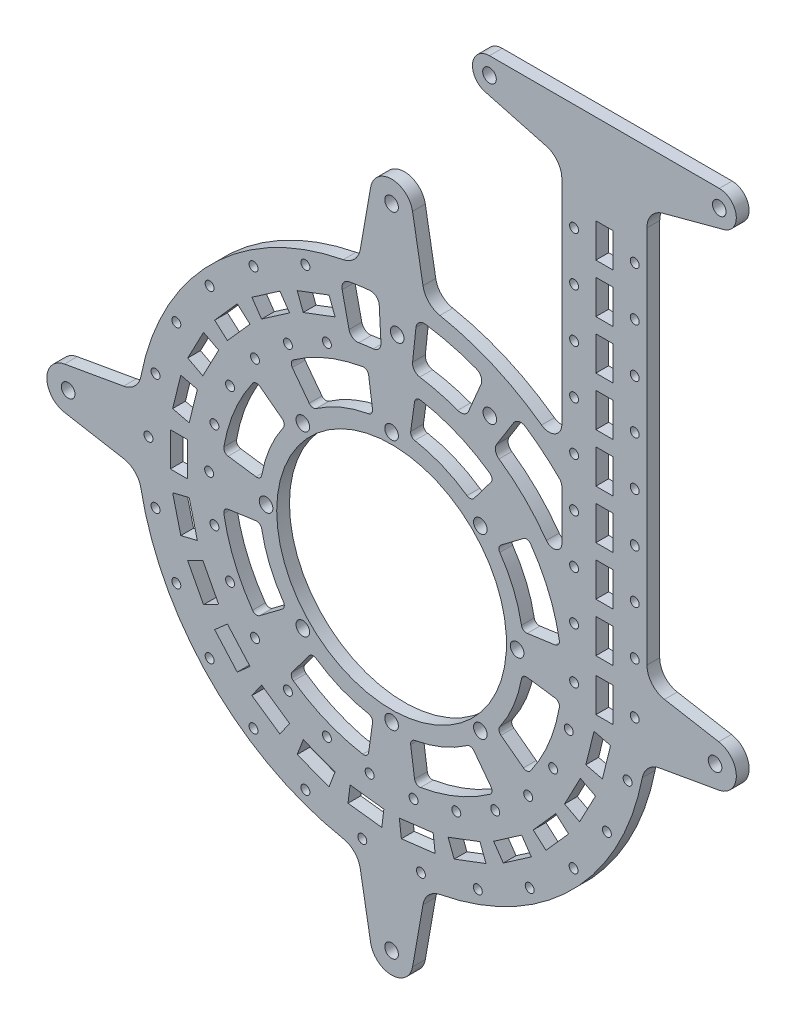
from build123d import *

# Parameters (mm, degrees)
SKETCH_1_W               = 200
SKETCH_1_H               = 300
EXTRUDE_1_DEPTH          = 3
SKETCH_7_R               = 27
CUT_EXTRUDE_4_DEPTH      = 10
SKETCH_3_W               = 4
SKETCH_3_H               = 8
CUT_EXTRUDE_2_DEPTH      = 10
SKETCH_5_OUTSIDE_W       = 274.114
SKETCH_5_OUTSIDE_H       = 374.114
CUT_EXTRUDE_3_DEPTH      = 10
SKETCH_8_R               = 1.6
CUT_EXTRUDE_5_DEPTH      = 10
PATTERN_CIRCULAR_1_COUNT = 26
SKETCH_9_R               = 1.6
CUT_EXTRUDE_6_DEPTH      = 10
PATTERN_CIRCULAR_2_COUNT = 8
SKETCH_11_W              = 4
SKETCH_11_H              = 8
CUT_EXTRUDE_7_DEPTH      = 10
PATTERN_LINEAR_1_COUNT   = 8
PATTERN_LINEAR_1_PITCH   = 11.5
EXTRUDE_START            = -3
EXTRUDE_2_DEPTH          = 3
SKETCH_13_R              = 1.05
CUT_EXTRUDE_8_DEPTH      = 10
PATTERN_CIRCULAR_3_COUNT = 26
SKETCH_14_R              = 1.05
CUT_EXTRUDE_9_DEPTH      = 10
PATTERN_LINEAR_2_COUNT   = 8
PATTERN_LINEAR_2_PITCH   = 11.5
SKETCH_15_R              = 1.6
CUT_EXTRUDE_10_DEPTH     = 10
CUT_EXTRUDE_11_DEPTH     = 10
CUT_EXTRUDE_12_DEPTH     = 10
FILLET_1_R               = 2


with BuildPart() as part:
    # 草图1 → 凸台-拉伸1 (new body)
    with BuildSketch(Plane.XY):
        Rectangle(SKETCH_1_W, SKETCH_1_H)
    extrude(amount=EXTRUDE_1_DEPTH)

    # 草图7 → 切除-拉伸4 (cut)
    with BuildSketch(Plane(origin=(0, 0, 0), x_dir=(-1, 0, 0), z_dir=(0, 0, -1))):
        Circle(SKETCH_7_R)
    extrude(amount=-CUT_EXTRUDE_4_DEPTH, mode=Mode.SUBTRACT)

    # 草图3 → 切除-拉伸2 (cut)
    with BuildSketch(Plane(origin=(0, 0, 0), x_dir=(-1, 0, 0), z_dir=(0, 0, -1))):
        with Locations((50, 0)):
            Rectangle(SKETCH_3_W, SKETCH_3_H)
    cut_extrude_2 = extrude(amount=-CUT_EXTRUDE_2_DEPTH, mode=Mode.SUBTRACT)

    # 草图5 outside → 切除-拉伸3 (cut)
    with BuildSketch(Plane.XY.offset(3)):
        Rectangle(SKETCH_5_OUTSIDE_W, SKETCH_5_OUTSIDE_H)
        with BuildLine():
            Line((40, 101.064727818), (40, 50.990195136))
            ThreePointArc((40, 50.990195136), (38.362770288, 48.317582717), (35.238095238, 48.562090606))
            ThreePointArc((35.238095238, 48.562090606), (23.864678316, 55.049769562), (11.354741948, 58.91578596))
            ThreePointArc((11.354741948, 58.91578596), (8.73750949, 60.31805029), (7.376931679, 62.957193902))
            Line((7.376931679, 62.957193902), (4.924038765, 76.868240888))
            ThreePointArc((4.924038765, 76.868240888), (0, 81), (-4.924038765, 76.868240888))
            Line((-4.924038765, 76.868240888), (-7.376931679, 62.957193902))
            ThreePointArc((-7.376931679, 62.957193902), (-8.73750949, 60.31805029), (-11.354741948, 58.91578596))
            ThreePointArc((-11.354741948, 58.91578596), (-42.426406871, 42.426406871), (-58.91578596, 11.354741948))
            ThreePointArc((-58.91578596, 11.354741948), (-60.31805029, 8.73750949), (-62.957193902, 7.376931679))
            Line((-62.957193902, 7.376931679), (-76.868240888, 4.924038765))
            ThreePointArc((-76.868240888, 4.924038765), (-81, 0), (-76.868240888, -4.924038765))
            Line((-76.868240888, -4.924038765), (-62.957193902, -7.376931679))
            ThreePointArc((-62.957193902, -7.376931679), (-60.31805029, -8.73750949), (-58.91578596, -11.354741948))
            ThreePointArc((-58.91578596, -11.354741948), (-42.426406871, -42.426406871), (-11.354741948, -58.91578596))
            ThreePointArc((-11.354741948, -58.91578596), (-8.73750949, -60.31805029), (-7.376931679, -62.957193902))
            Line((-7.376931679, -62.957193902), (-4.924038765, -76.868240888))
            ThreePointArc((-4.924038765, -76.868240888), (0, -81), (4.924038765, -76.868240888))
            Line((4.924038765, -76.868240888), (7.376931679, -62.957193902))
            ThreePointArc((7.376931679, -62.957193902), (8.73750949, -60.31805029), (11.354741948, -58.91578596))
            ThreePointArc((11.354741948, -58.91578596), (42.426406871, -42.426406871), (58.91578596, -11.354741948))
            ThreePointArc((58.91578596, -11.354741948), (60.31805029, -8.73750949), (62.957193902, -7.376931679))
            Line((62.957193902, -7.376931679), (76.868240888, -4.924038765))
            ThreePointArc((76.868240888, -4.924038765), (81, 0), (76.868240888, 4.924038765))
            Line((76.868240888, 4.924038765), (64.131759112, 7.169824142))
            ThreePointArc((64.131759112, 7.169824142), (61.169777784, 8.879924858), (60, 12.093862907))
            Line((60, 12.093862907), (60, 101.064727818))
            ThreePointArc((60, 101.064727818), (61.033233299, 104.108534963), (63.705904774, 105.894356949))
            Line((63.705904774, 105.894356949), (78.03527618, 109.733900446))
            ThreePointArc((78.03527618, 109.733900446), (80.965779445, 114.11970852), (77, 117.597603751))
            Line((77, 117.597603751), (23, 117.597603751))
            ThreePointArc((23, 117.597603751), (19.034220555, 114.11970852), (21.96472382, 109.733900446))
            Line((21.96472382, 109.733900446), (36.294095226, 105.894356949))
            ThreePointArc((36.294095226, 105.894356949), (38.966766701, 104.108534963), (40, 101.064727818))
        make_face(mode=Mode.SUBTRACT)
    extrude(amount=-CUT_EXTRUDE_3_DEPTH, mode=Mode.SUBTRACT)

    # 草图8 → 切除-拉伸5 (cut)
    with BuildSketch(Plane(origin=(0, 0, 0), x_dir=(-1, 0, 0), z_dir=(0, 0, -1))):
        with Locations((76, 0)):
            Circle(SKETCH_8_R)
        with Locations((0, -76)):
            Circle(SKETCH_8_R)
        with Locations((-76, 0)):
            Circle(SKETCH_8_R)
        with Locations((0, 76)):
            Circle(SKETCH_8_R)
        with Locations((-23, 113.597603751)):
            Circle(SKETCH_8_R)
        with Locations((-77, 113.597603751)):
            Circle(SKETCH_8_R)
    extrude(amount=-CUT_EXTRUDE_5_DEPTH, mode=Mode.SUBTRACT)

    # 阵列(圆周)1: 切除-拉伸2 ×26 about axis, 3 skipped
    pattern_circular_1_axis = Axis((0, 0, 0), (0, 0, -1))
    add([cut_extrude_2.rotate(pattern_circular_1_axis, i * 360 / PATTERN_CIRCULAR_1_COUNT) for i in range(1, PATTERN_CIRCULAR_1_COUNT) if i not in (10, 11, 12)], mode=Mode.SUBTRACT)

    # 草图9 → 切除-拉伸6 (cut)
    with BuildSketch(Plane(origin=(0, 0, 0), x_dir=(-1, 0, 0), z_dir=(0, 0, -1))):
        with Locations((29.5, 0)):
            Circle(SKETCH_9_R)
        with BuildLine():
            Line((31.86448148, 4.478260825), (38.404020562, 5.397333106))
            ThreePointArc((38.404020562, 5.397333106), (39.206429868, 5.878384948), (39.419600867, 6.789334833))
            ThreePointArc((39.419600867, 6.789334833), (36.9551813, 15.307337295), (32.674651785, 23.073082384))
            ThreePointArc((32.674651785, 23.073082384), (31.879778285, 23.566486567), (30.972234204, 23.339252525))
            Line((30.972234204, 23.339252525), (25.69819953, 19.364982337))
            ThreePointArc((25.69819953, 19.364982337), (25.235374749, 18.595744926), (25.435767214, 17.720658741))
            ThreePointArc((25.435767214, 17.720658741), (28.640265508, 11.863186403), (30.516201445, 5.455405519))
            ThreePointArc((30.516201445, 5.455405519), (30.993281949, 4.694927272), (31.86448148, 4.478260825))
        make_face()
    cut_extrude_6 = extrude(amount=-CUT_EXTRUDE_6_DEPTH, mode=Mode.SUBTRACT)

    # 阵列(圆周)2: 切除-拉伸6 ×8 about axis
    pattern_circular_2_axis = Axis((0, 0, 0), (0, 0, 1))
    for i in range(1, PATTERN_CIRCULAR_2_COUNT):
        add(cut_extrude_6.rotate(pattern_circular_2_axis, i * 360 / PATTERN_CIRCULAR_2_COUNT), mode=Mode.SUBTRACT)

    # 草图11 → 切除-拉伸7 (cut)
    with BuildSketch(Plane(origin=(0, 0, 0), x_dir=(-1, 0, 0), z_dir=(0, 0, -1))):
        with Locations((-50, 12)):
            Rectangle(SKETCH_11_W, SKETCH_11_H)
    cut_extrude_7 = extrude(amount=-CUT_EXTRUDE_7_DEPTH, mode=Mode.SUBTRACT)

    # 阵列(线性)1: 切除-拉伸7 ×8
    with Locations(*[(0, i * PATTERN_LINEAR_1_PITCH, 0) for i in range(1, PATTERN_LINEAR_1_COUNT)]):
        add(cut_extrude_7, mode=Mode.SUBTRACT)

    # 草图12 → 凸台-拉伸2 (add)
    with BuildSketch(Plane.XY.offset(3).offset(EXTRUDE_START)):
        with BuildLine():
            Line((-9.676875824, 38.811829051), (-14.515313736, 58.217743577))
            ThreePointArc((-14.515313736, 58.217743577), (14.006721831, 58.342195224), (39.363541739, 45.282574813))
            Line((39.363541739, 45.282574813), (26.24236116, 30.188383209))
            ThreePointArc((26.24236116, 30.188383209), (9.337814554, 38.894796816), (-9.676875824, 38.811829051))
        make_face()
    extrude(amount=EXTRUDE_2_DEPTH)

    # 草图13 → 切除-拉伸8 (cut)
    with BuildSketch(Plane.XY.offset(3)):
        with Locations((42.875, 0)):
            Circle(SKETCH_13_R)
        with Locations((57.125, 0)):
            Circle(SKETCH_13_R)
    cut_extrude_8 = extrude(amount=-CUT_EXTRUDE_8_DEPTH, mode=Mode.SUBTRACT)

    # 阵列(圆周)3: 切除-拉伸8 ×26 about axis, 7 skipped
    pattern_circular_3_axis = Axis((0, 0, 0), (0, 0, -1))
    add([cut_extrude_8.rotate(pattern_circular_3_axis, i * 360 / PATTERN_CIRCULAR_3_COUNT) for i in range(1, PATTERN_CIRCULAR_3_COUNT) if i not in (19, 20, 21, 22, 23, 24, 25)], mode=Mode.SUBTRACT)

    # 草图14 → 切除-拉伸9 (cut)
    with BuildSketch(Plane.XY.offset(3)):
        with Locations((57.125, 12.00451573)):
            Circle(SKETCH_14_R)
        with Locations(Location((42.875, 12.00451573, 0), (0, 0, 180))):
            Circle(SKETCH_14_R)
    cut_extrude_9 = extrude(amount=-CUT_EXTRUDE_9_DEPTH, mode=Mode.SUBTRACT)

    # 阵列(线性)2: 切除-拉伸9 ×8
    with Locations(*[(0, i * PATTERN_LINEAR_2_PITCH, 0) for i in range(1, PATTERN_LINEAR_2_COUNT)]):
        add(cut_extrude_9, mode=Mode.SUBTRACT)

    # 草图15 → 切除-拉伸10 (cut)
    with BuildSketch(Plane(origin=(0, 0, 0), x_dir=(-1, 0, 0), z_dir=(0, 0, -1))):
        with Locations((-1.308847415, 49.982866249)):
            Circle(SKETCH_15_R)
        with Locations((-23.087430662, 44.350541659)):
            Circle(SKETCH_15_R)
    extrude(amount=-CUT_EXTRUDE_10_DEPTH, mode=Mode.SUBTRACT)

    # 草图16 → 切除-拉伸11 (cut)
    with BuildSketch(Plane.XY.offset(3)):
        with BuildLine():
            Line((4.719920696, 44.248981329), (5.939675482, 55.684111335))
            ThreePointArc((5.939675482, 55.684111335), (14.021280227, 54.216267861), (21.801235639, 51.582032963))
            Line((21.801235639, 51.582032963), (17.324196178, 40.989294051))
            ThreePointArc((17.324196178, 40.989294051), (11.14191018, 43.082569997), (4.719920696, 44.248981329))
        make_face()
        with BuildLine():
            Line((-2.397639458, 44.435361201), (-3.017254149, 55.918656792))
            ThreePointArc((-3.017254149, 55.918656792), (-7.562899043, 55.48695845), (-12.058263076, 54.68636294))
            Line((-12.058263076, 54.68636294), (-9.582012623, 43.456127693))
            ThreePointArc((-9.582012623, 43.456127693), (-6.009803704, 44.092315197), (-2.397639458, 44.435361201))
        make_face()
    extrude(amount=-CUT_EXTRUDE_11_DEPTH, mode=Mode.SUBTRACT)

    # 草图17 → 切除-拉伸12 (cut)
    with BuildSketch(Plane.XY.offset(3)):
        with BuildLine():
            Line((40, 39.191835885), (40, 19.5))
            ThreePointArc((40, 19.5), (33.095743502, 29.747634563), (23.63971331, 37.701643925))
            Line((23.63971331, 37.701643925), (29.748852704, 47.444765389))
            ThreePointArc((29.748852704, 47.444765389), (35.117706712, 43.620484583), (40, 39.191835885))
        make_face()
    extrude(amount=-CUT_EXTRUDE_12_DEPTH, mode=Mode.SUBTRACT)

    # 圆角1
    fillet_1_edges = [part.edges().sort_by_distance(p)[0] for p in [
        (17.324196178, 40.989294051, 1.5),
        (4.719920696, 44.248981329, 1.5),
        (5.939675482, 55.684111335, 1.5),
        (21.801235639, 51.582032963, 1.5),
        (-2.397639458, 44.435361201, 1.5),
        (-9.582012623, 43.456127693, 1.5),
        (-12.058263076, 54.68636294, 1.5),
        (-3.017254149, 55.918656792, 1.5),
        (40, 19.5, 1.5),
        (23.63971331, 37.701643925, 1.5),
        (29.748852704, 47.444765389, 1.5),
        (40, 39.191835885, 1.5),
    ]]
    fillet(fillet_1_edges, radius=FILLET_1_R)


solid = part.part
